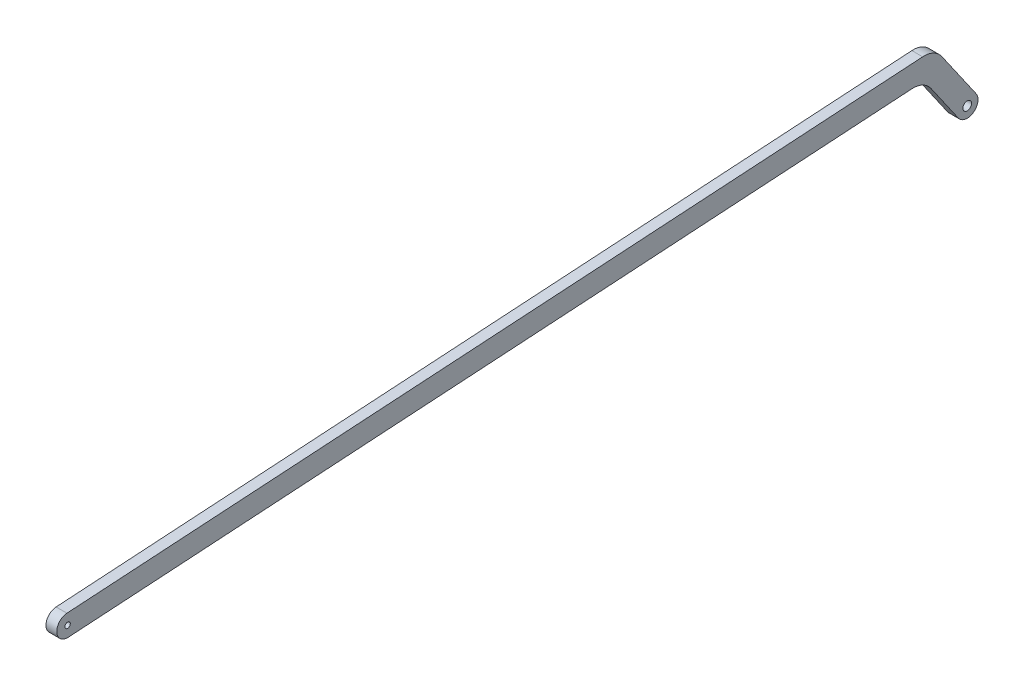
from build123d import *

# Parameters (mm, degrees)
SKETCH3_R           = 2.5527
SKETCH3_R_2         = 1.6
BOSS_EXTRUDE1_DEPTH = 6.35
FILLET1_R           = 12.7


with BuildPart() as part:
    # Sketch3 → Boss-Extrude1 (new body)
    with BuildSketch(Plane(origin=(0, 0, 0), x_dir=(0, 0, -1), z_dir=(1, 0, 0))):
        with BuildLine():
            Line((510.099944108, 38.525043363), (-0.399581899, 6.337415428))
            ThreePointArc((-0.399581899, 6.337415428), (-6.337415428, -0.399581899), (0.399581899, -6.337415428))
            Line((0.399581899, -6.337415428), (503.75868514, 25.4))
            Line((503.75868514, 25.4), (523.945522177, -3.625662963))
            ThreePointArc((523.945522177, -3.625662963), (532.784348103, -5.213162963), (534.371848103, 3.625662963))
            Line((534.371848103, 3.625662963), (510.099944108, 38.525043363))
        make_face()
        with Locations((529.15868514, 0)):
            Circle(SKETCH3_R, mode=Mode.SUBTRACT)
        Circle(SKETCH3_R_2, mode=Mode.SUBTRACT)
    extrude(amount=BOSS_EXTRUDE1_DEPTH)

    # Fillet1
    fillet1_edges = [part.edges().sort_by_distance(p)[0] for p in [
        (3.175, 38.525043363, -510.099944108),
        (3.175, 25.4, -503.75868514),
    ]]
    fillet(fillet1_edges, radius=FILLET1_R)


solid = part.part
